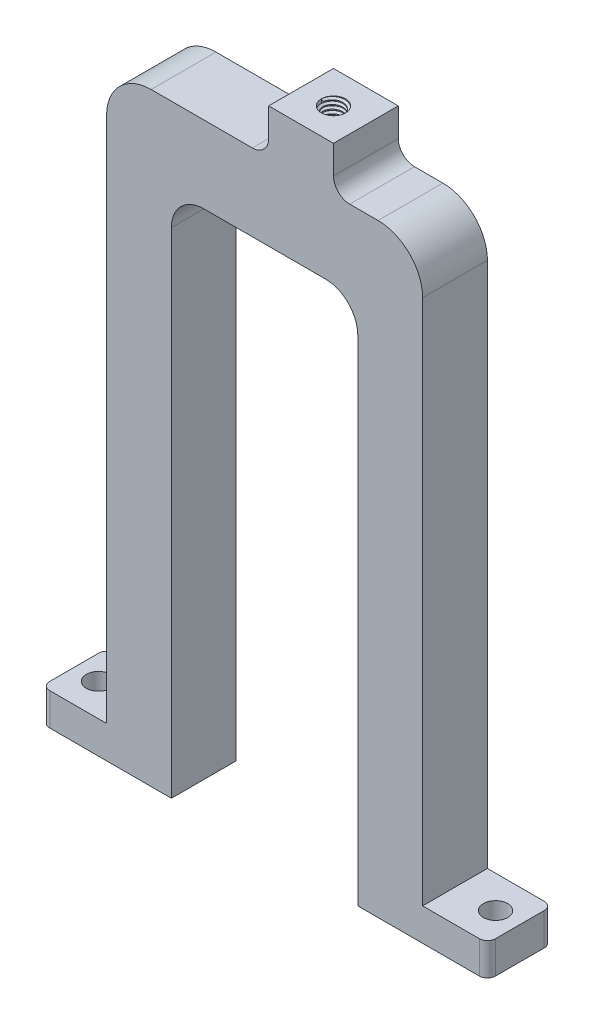
from build123d import *

# Parameters (mm, degrees)
BOSS_EXTRUDE1_DEPTH = 16
SKETCH2_R           = 3
CUT_EXTRUDE1_DEPTH  = 15
FILLET1_R           = 2
SKETCH3_R           = 3
CUT_EXTRUDE2_DEPTH  = 163.434602225
THREAD1_PITCH       = 1


with BuildPart() as part:
    # Sketch1 → Boss-Extrude1 (new body)
    with BuildSketch(Plane.XY):
        with BuildLine():
            ThreePointArc((-23, -8), (-20.656854249, -2.343145751), (-15, 0))
            Line((-15, 0), (0, 0))
            Line((0, 0), (0, 20.354248689))
            ThreePointArc((0, 20.354248689), (-1.354248689, 19.354248689), (-3, 19))
            Line((-3, 19), (-4, 19))
            Line((-4, 19), (-17, 19))
            Line((-17, 19), (-28, 19))
            ThreePointArc((-28, 19), (-35.778174593, 15.778174593), (-39, 8))
            Line((-39, 8), (-39, -122))
            Line((-39, -122), (-55, -122))
            Line((-55, -122), (-55, -130))
            Line((-55, -130), (-23, -130))
            Line((-23, -130), (-23, -8))
        make_face()
        with BuildLine():
            Line((0, 20.354248689), (0, 0))
            Line((0, 0), (15, 0))
            ThreePointArc((15, 0), (20.656854249, -2.343145751), (23, -8))
            Line((23, -8), (23, -130))
            Line((23, -130), (55, -130))
            Line((55, -130), (55, -122))
            Line((55, -122), (39, -122))
            Line((39, -122), (39, 8))
            ThreePointArc((39, 8), (35.778174593, 15.778174593), (28, 19))
            Line((28, 19), (21, 19))
            ThreePointArc((21, 19), (18.171572875, 20.171572875), (17, 23))
            Line((17, 23), (17, 30))
            Line((17, 30), (1, 30))
            Line((1, 30), (1, 23))
            ThreePointArc((1, 23), (0.741657387, 21.585786438), (0, 20.354248689))
        make_face()
    extrude(amount=BOSS_EXTRUDE1_DEPTH)

    # Sketch2 → Cut-Extrude1 (cut)
    with BuildSketch(Plane(origin=(0, 30, 0), x_dir=(1, 0, 0), z_dir=(0, 1, 0))):
        with Locations(Location((9, -8, 0), (0, 0, 270))):
            Circle(SKETCH2_R)
    extrude(amount=-CUT_EXTRUDE1_DEPTH, mode=Mode.SUBTRACT)

    # Fillet1
    fillet1_edges = [part.edges().sort_by_distance(p)[0] for p in [
        (-55, -126, 0),
        (55, -126, 16),
        (55, -126, 0),
        (-55, -126, 16),
    ]]
    fillet(fillet1_edges, radius=FILLET1_R)

    # Sketch3 → Cut-Extrude2 (cut, through all)
    with BuildSketch(Plane(origin=(0, -122, 0), x_dir=(1, 0, 0), z_dir=(0, 1, 0))):
        with Locations(Location((-49, -8, 0), (0, 0, 180))):
            Circle(SKETCH3_R)
        with Locations((49, -8)):
            Circle(SKETCH3_R)
    extrude(amount=-CUT_EXTRUDE2_DEPTH, mode=Mode.SUBTRACT)

    # Thread1: the profile of Thread Profile1 profile screwed along a right-hand helix of 15 turns, 8 arcs to a turn; built about Z, then put on its axis
    thread1_z = Axis((0, 0, 0), (0, 0, 1))
    thread1_corners = [(3.0003, 0, -0.000173205), (3.0003, 0, 0.875173202), (2.458734125, 0, 0.562499999), (2.458734125, 0, 0.312499999)]
    with BuildLine(mode=Mode.PRIVATE) as thread1_profile:
        Line(thread1_corners[0], thread1_corners[1])
        Line(thread1_corners[1], thread1_corners[2])
        Line(thread1_corners[2], thread1_corners[3])
        Line(thread1_corners[3], thread1_corners[0])
    thread1_cap = Face(thread1_profile.wire())
    thread1_turn_angles = [0, 22.5, 45, 67.5, 90, 112.5, 135, 157.5, 180, 202.5, 225, 247.5, 270, 292.5, 315, 337.5, 360]
    thread1_turn_weights = [1, 0.9238795325112867, 1, 0.9238795325112867, 1, 0.9238795325112867, 1, 0.9238795325112867, 1, 0.9238795325112867, 1, 0.9238795325112867, 1, 0.9238795325112867, 1, 0.9238795325112867, 1]
    thread1_turn_rails = [Edge.make_bspline([Vector(p[0], p[1], 0).rotate(thread1_z, thread1_turn_angles[k]) / thread1_turn_weights[k] + Vector(0, 0, p[2] + THREAD1_PITCH * thread1_turn_angles[k] / 360) for k in range(17)], [0, 0, 0, 1, 1, 2, 2, 3, 3, 4, 4, 5, 5, 6, 6, 7, 7, 8, 8, 8], 2, thread1_turn_weights) for p in thread1_corners]
    thread1_turn_sides = [Face.make_surface_from_curves(thread1_turn_rails[p[0]], thread1_turn_rails[p[1]]) for p in [(0, 1), (1, 2), (2, 3), (3, 0)]]
    thread1 = Plane(origin=(9, 30, 8), x_dir=(-1, 0, 0), z_dir=(0, -1, 0)) * Solid(Shell([*[p.moved(Location((0, 0, THREAD1_PITCH * i))) for i in range(15) for p in thread1_turn_sides], thread1_cap, thread1_cap.rotate(thread1_z, 5400).moved(Location((0, 0, THREAD1_PITCH * 5400 / 360)))]))
    add(thread1)


solid = part.part
